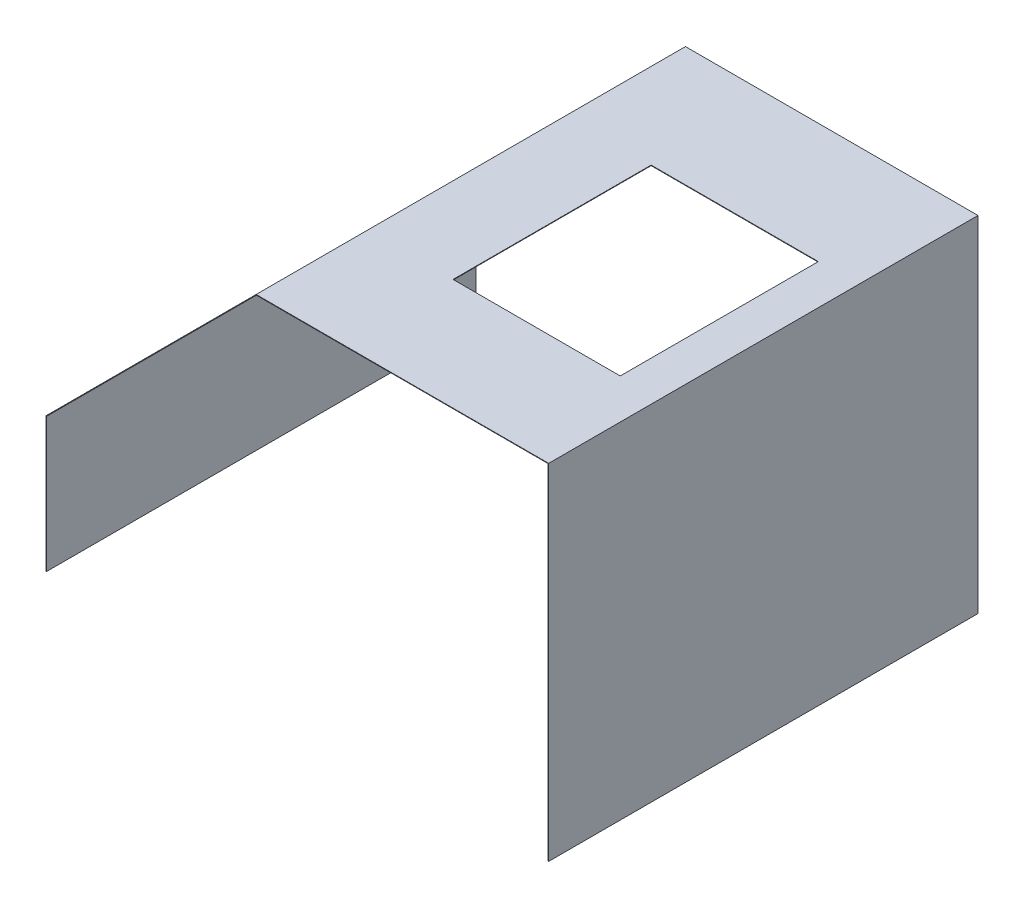
from build123d import *

# Parameters (mm, degrees)
SALIENTE_EXTRUIR1_DEPTH    = 0.83566
SALIENTE_EXTRUIR2_DEPTH    = 12.7
SALIENTE_EXTRUIR3_DEPTH    = 642.126
CROQUIS4_W                 = 255
CROQUIS4_H                 = 0.83566
SALIENTE_EXTRUIR4_DEPTH    = 170
CROQUIS5_W                 = 255
CROQUIS5_H                 = 0.83566
SALIENTE_EXTRUIR5_DEPTH    = 170
CROQUIS6_W                 = 560
CROQUIS6_H                 = 350
CORTAR_EXTRUIR1_DEPTH      = 190
CORTAR_EXTRUIR2_DEPTH      = 198
CORTAR_EXTRUIR2_DEPTH_BACK = 174


with BuildPart() as part:
    # Croquis1 → Saliente-Extruir1 (new body)
    with BuildSketch(Plane.XY):
        Polygon((0, 0), (765, 0), (765, 525), (320, 525), (0, 205), align=None)
    extrude(amount=SALIENTE_EXTRUIR1_DEPTH)

    # Croquis7 → Cortar-Extruir2 (cut, two sides: drawn at the far end of the back side and taken through both)
    with BuildSketch(Plane.XY.offset(0.83566).offset(-CORTAR_EXTRUIR2_DEPTH_BACK)):
        Polygon((0, 0), (765, 0), (765, 525), (320, 525), (0, 205), align=None)
    extrude(amount=CORTAR_EXTRUIR2_DEPTH + CORTAR_EXTRUIR2_DEPTH_BACK, mode=Mode.SUBTRACT)


with BuildPart() as body_2:
    # Croquis2 → Saliente-Extruir2 (new body)
    with BuildSketch(Plane.XY.offset(0.83566)):
        Polygon((765.83566, 525.83566), (319.653858294, 525.83566), (-0.83566, 205.346141706), (-0.83566, 0), (0, 0), (0, 205), (320, 525), (765, 525), (765, 0), (765.83566, 0), align=None)
    extrude(amount=SALIENTE_EXTRUIR2_DEPTH)

    # Croquis3 → Saliente-Extruir3 (add)
    with BuildSketch(Plane.XY.offset(13.53566)):
        Polygon((450, 525.83566), (450, 525), (320, 525), (0, 205), (0, 0), (-0.83566, 0), (-0.83566, 205.346141706), (319.653858294, 525.83566), align=None)
        Polygon((765.83566, 0), (765.83566, 525.83566), (705, 525.83566), (705, 525), (765, 525), (765, 0), align=None)
    extrude(amount=SALIENTE_EXTRUIR3_DEPTH)

    # Croquis4 → Saliente-Extruir4 (add)
    with BuildSketch(Plane.XY.offset(13.53566)):
        with Locations((577.5, 525.41783)):
            Rectangle(CROQUIS4_W, CROQUIS4_H)
    extrude(amount=SALIENTE_EXTRUIR4_DEPTH)

    # Croquis5 → Saliente-Extruir5 (add)
    with BuildSketch(Plane.XY.offset(655.66166)):
        with Locations((577.5, 525.41783)):
            Rectangle(CROQUIS5_W, CROQUIS5_H)
    extrude(amount=-SALIENTE_EXTRUIR5_DEPTH)

    # Croquis6 → Cortar-Extruir1 (cut)
    with BuildSketch(Plane(origin=(-103.090900853, 103.090900853, 0), x_dir=(0, 0, 1), z_dir=(-0.7071067811865477, 0.7071067811865475, 0))):
        with Locations((328.24866, 371.231060123)):
            Rectangle(CROQUIS6_W, CROQUIS6_H)
    extrude(amount=-CORTAR_EXTRUIR1_DEPTH, mode=Mode.SUBTRACT)


solid = body_2.part
